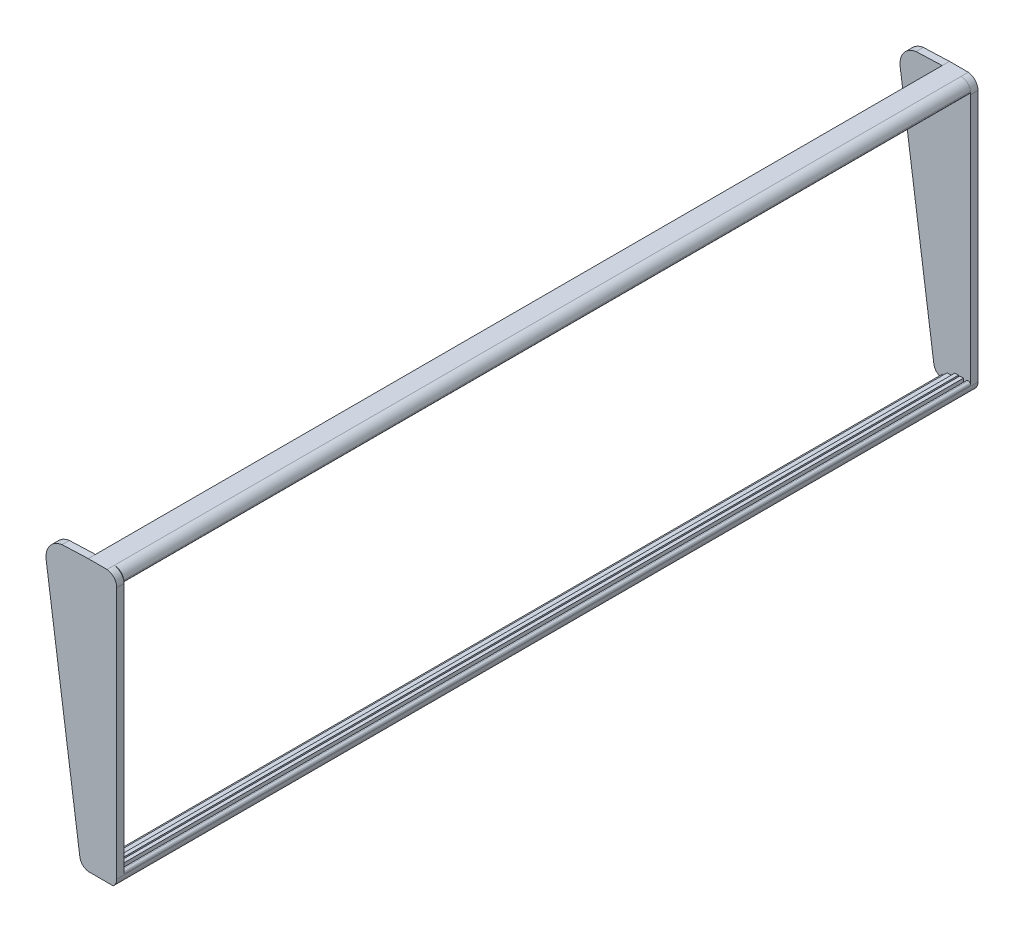
from build123d import *

# Parameters (mm, degrees)
RAIL_W                    = 3.2
RAIL_H                    = 1.5
RAIL_W_2                  = 1.5
RAIL_H_2                  = 3
RAIL_W_3                  = 10.292519685
BOSS_EXTRUDE1_DEPTH       = 350
BOSS_EXTRUDE2_OUTLINE_W   = 350
BOSS_EXTRUDE2_OUTLINE_H   = 4.5
BOSS_EXTRUDE2_DEPTH       = 1.5
BOSS_EXTRUDE2_2_OUTLINE_W = 350
BOSS_EXTRUDE2_2_OUTLINE_H = 4.5
BOSS_EXTRUDE2_2_DEPTH     = 1.5
FILLET1_R                 = 4
FILLET2_R                 = 4
BOSS_EXTRUDE3_DEPTH       = 3
FILLET3_R                 = 1
FILLET4_R                 = 1
LPATTERN1_COUNT           = 2
LPATTERN1_PITCH           = 353


# Read off the part's stored shape, not the designer's step: Boss-Extrude2
with BuildPart() as part:
    # rail → Boss-Extrude1 (new body)
    with BuildSketch(Plane.XY):
        with Locations((0, -24.462398)):
            Rectangle(RAIL_W, RAIL_H)
        Polygon((1.6, -23.712398), (1.6, -25.212398), (1.6, -26.712398), (3.1, -26.712398), (3.1, -23.712398), align=None)
        with Locations((4.442519685, -25.21)):
            Rectangle(RAIL_W_2, RAIL_H_2)
        with Locations((5.942519685, -24.46)):
            Rectangle(RAIL_W_2, RAIL_H)
        with Locations((5.942519685, -131.96)):
            Rectangle(RAIL_W_2, RAIL_H)
        with Locations((4.442519685, -131.21)):
            Rectangle(RAIL_W_2, RAIL_H_2)
        Polygon((1.6, -129.710002609), (1.6, -131.210002609), (1.6, -132.710002609), (3.1, -132.710002609), (3.1, -129.710002609), align=None)
        with Locations((0, -131.960002609)):
            Rectangle(RAIL_W, RAIL_H)
        with Locations((1.546259843, -22.96)):
            Rectangle(RAIL_W_3, RAIL_H)
        with Locations((1.546259843, -133.46)):
            Rectangle(RAIL_W_3, RAIL_H)
    extrude(amount=-BOSS_EXTRUDE1_DEPTH)

    # Boss-Extrude2 outline → Boss-Extrude2 (add)
    with BuildSketch(Plane(origin=(6.692519685, 0, 0), x_dir=(0, 0, -1), z_dir=(1, 0, 0))):
        with Locations((175, -24.46)):
            Rectangle(BOSS_EXTRUDE2_OUTLINE_W, BOSS_EXTRUDE2_OUTLINE_H)
    extrude(amount=BOSS_EXTRUDE2_DEPTH)

    # Fillet1
    fillet1_edges = [part.edges().sort_by_distance(p)[0] for p in [
        (8.192519685, -22.21, -175),
    ]]
    fillet(fillet1_edges, radius=FILLET1_R)



with BuildPart() as body_2:
    # Boss-Extrude2 2 outline → Boss-Extrude2 2 (new body)
    with BuildSketch(Plane(origin=(6.692519685, 0, 0), x_dir=(0, 0, -1), z_dir=(1, 0, 0))):
        with Locations((175, -131.96)):
            Rectangle(BOSS_EXTRUDE2_2_OUTLINE_W, BOSS_EXTRUDE2_2_OUTLINE_H)
    extrude(amount=BOSS_EXTRUDE2_2_DEPTH)

    # Fillet2
    # the kernel refuses this fillet: 4 mm, written as the material it takes off along each edge
    with BuildSketch(Plane(origin=(8.192519685, -134.21, 7.806247498), x_dir=(-1, 0, 0), z_dir=(0, 0, -1))) as fillet2_piece_1:
        with BuildLine():
            CenterArc((4, 3.122498999), FILLET2_R, 180, 51.317812547)
            Line((0, 3.122498999), (-0.08, 3.122498999))
            Line((-0.08, 3.122498999), (-0.08, 0))
            Line((-0.08, 0), (0, -0.08))
            ThreePointArc((0, -0.08), (0.75, -0.08), (1.45, -0.06244998))
            Line((1.45, -0.06244998), (1.5, 0))
        make_face()
    extrude(amount=365.612494996, mode=Mode.SUBTRACT)


with BuildPart() as part_1:
    add(part.part)

    add(body_2.part)  # Boss-Extrude3 merges body 2
    # side → Boss-Extrude3 (add)
    with BuildSketch(Plane.XY):
        with BuildLine():
            Line((8.192519685, -26.71), (8.192519685, -129.71))
            Line((8.192519685, -129.71), (8.192519685, -131.087501001))
            ThreePointArc((8.192519685, -131.087501001), (7.798070961, -132.819551808), (6.692519685, -134.21))
            Line((6.692519685, -134.21), (-3.6, -134.21))
            ThreePointArc((-3.6, -134.21), (-5.909675728, -133.059247145), (-7.060428583, -130.749571417))
            Line((-7.060428583, -130.749571417), (-14.282896215, -79.148969011))
            Line((-14.282896215, -79.148969011), (-20.976742465, -31.325078818))
            ThreePointArc((-20.976742465, -31.325078818), (-19.494827467, -25.608174313), (-14.404493379, -22.613584515))
            Line((-14.404493379, -22.613584515), (-3.6, -22.21))
            Line((-3.6, -22.21), (4.192519685, -22.21))
            ThreePointArc((4.192519685, -22.21), (7.04796816, -23.699601355), (8.192519685, -26.71))
        make_face()
    boss_extrude3 = extrude(amount=BOSS_EXTRUDE3_DEPTH)

    # Fillet3
    fillet3_edges = [part_1.edges().sort_by_distance(p)[0] for p in [
        (8.192519685, -129.71, -175),
    ]]
    fillet(fillet3_edges, radius=FILLET3_R)

    # Fillet4
    # the kernel refuses this fillet: 1 mm, written as the material it takes off along each edge
    with BuildSketch(Plane(origin=(8.192519685, -26.71, 0), x_dir=(-0.047899365984683646, 0.9988521666083853, 0), z_dir=(0, 0, -1))) as fillet4_piece_1:
        with BuildLine():
            CenterArc((1.048761395, -0.992864746), FILLET4_R, 83.151413818, 99.594068227)
            Line((0.049909229, -1.040764112), (-0.049975988, -1.045554048))
            Line((-0.049975988, -1.045554048), (-0.099885217, -0.004789937))
            Line((-0.099885217, -0.004789937), (-0.004789937, 0.099885217))
            ThreePointArc((-0.004789937, 0.099885217), (0.494636147, 0.1238349), (1.179931939, 0.099286475))
            Line((1.179931939, 0.099286475), (1.168007344, 0))
        make_face()
    extrude(amount=352.920018361, mode=Mode.SUBTRACT)

    # LPattern1: Boss-Extrude3 ×2
    with Locations(*[(0, 0, -i * LPATTERN1_PITCH) for i in range(1, LPATTERN1_COUNT)]):
        add(boss_extrude3)


solid = part_1.part
